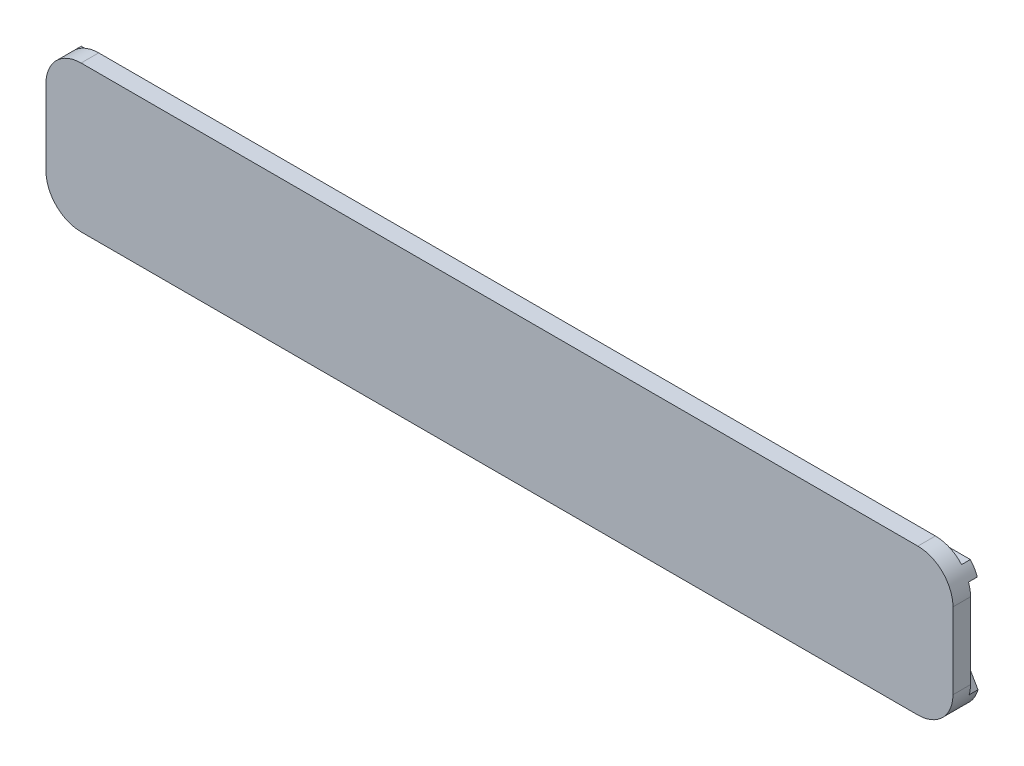
from build123d import *

# Parameters (mm, degrees)
SKETCH1_W           = 155
SKETCH1_H           = 25
SKETCH1_R           = 3.3
BOSS_EXTRUDE1_DEPTH = 2
SKETCH2_W           = 155
SKETCH2_H           = 25
BOSS_EXTRUDE2_DEPTH = 1
BOSS_EXTRUDE4_DEPTH = 1.5
FILLET1_R           = 6


with BuildPart() as part:
    # Sketch1 → Boss-Extrude1 (new body)
    with BuildSketch(Plane.XY):
        with Locations((27.85, 0)):
            Rectangle(SKETCH1_W, SKETCH1_H)
        Circle(SKETCH1_R, mode=Mode.SUBTRACT)
        with Locations((55.7, 0)):
            Circle(SKETCH1_R, mode=Mode.SUBTRACT)
    extrude(amount=-BOSS_EXTRUDE1_DEPTH)

    # Sketch2 → Boss-Extrude2 (add)
    with BuildSketch(Plane.XY):
        with Locations((27.85, 0)):
            Rectangle(SKETCH2_W, SKETCH2_H)
    extrude(amount=BOSS_EXTRUDE2_DEPTH)

    # Sketch5 → Boss-Extrude4 (add)
    with BuildSketch(Plane(origin=(0, 0, -2), x_dir=(-1, 0, 0), z_dir=(0, 0, -1))):
        Polygon((-95.535045424, 8.5), (-105.35, -8.5), (-105.35, -10.5), (-27.85, -10.5), (-27.85, -8.5), (-28.85, -8.5), (-38.664954576, 8.5), (-27.85, 8.5), (-27.85, 10.5), (-105.35, 10.5), (-105.35, 8.5), align=None)
        Polygon((-40.974355653, 8.5), (-31.159401077, -8.5), (-47.529491924, -8.5), (-42.974355653, 8.5), align=None, mode=Mode.SUBTRACT)
        Polygon((-45.044908014, 8.5), (-49.600044285, -8.5), (-74.791887617, -8.5), (-64.976933041, 8.5), align=None, mode=Mode.SUBTRACT)
        Polygon((-67.286334118, 8.5), (-77.101288694, -8.5), (-79.101288694, -8.5), (-88.91624327, 8.5), align=None, mode=Mode.SUBTRACT)
        Polygon((-91.225644347, 8.5), (-81.410689771, -8.5), (-103.040598923, -8.5), (-93.225644347, 8.5), align=None, mode=Mode.SUBTRACT)
    boss_extrude4 = extrude(amount=BOSS_EXTRUDE4_DEPTH)

    # Mirror1: Boss-Extrude4 across plane
    add(boss_extrude4.mirror(Plane(origin=(27.85, 0, 0), x_dir=(0, 0, 1), z_dir=(1, 0, 0))))

    # Fillet1
    fillet1_edges = [part.edges().sort_by_distance(p)[0] for p in [
        (105.35, 12.5, -0.5),
        (105.35, -12.5, -0.5),
        (-49.65, -12.5, -0.5),
        (-49.65, 12.5, -0.5),
    ]]
    fillet(fillet1_edges, radius=FILLET1_R)


solid = part.part
